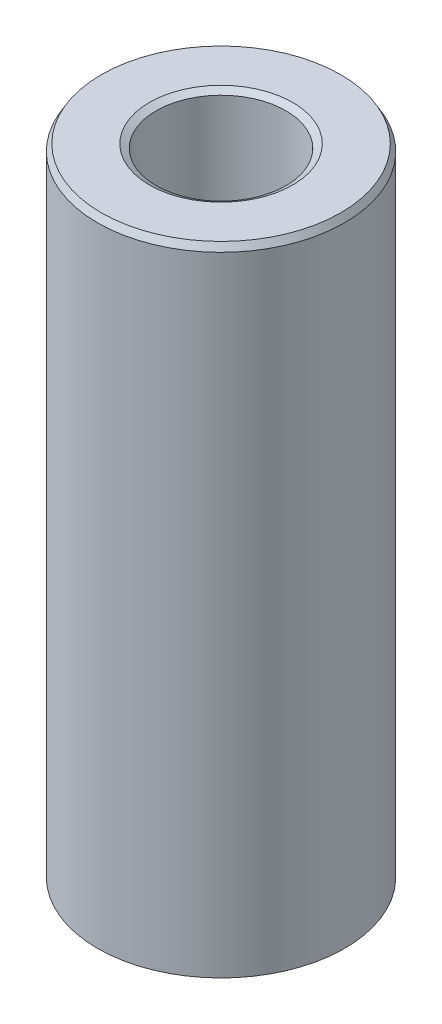
from build123d import *
from OCP.BRepFilletAPI import BRepFilletAPI_MakeChamfer

# Parameters (mm, degrees)
SKETCH1_R           = 52.5
BOSS_EXTRUDE1_DEPTH = 271.512539755
SKETCH2_R           = 27.581329118
CUT_EXTRUDE1_DEPTH  = 282.481010451
CHAMFER1_SIZE       = 2.849078489
CHAMFER1_SIZE2      = 1.644916233


with BuildPart() as part:
    # Sketch1 → Boss-Extrude1 (new body)
    with BuildSketch(Plane(origin=(0, 0, 0), x_dir=(1, 0, 0), z_dir=(0, 1, 0))):
        Circle(SKETCH1_R)
    extrude(amount=BOSS_EXTRUDE1_DEPTH)

    # Sketch2 → Cut-Extrude1 (cut, through all)
    with BuildSketch(Plane(origin=(0, 0, 0), x_dir=(1, 0, 0), z_dir=(0, 1, 0))):
        Circle(SKETCH2_R)
    extrude(amount=CUT_EXTRUDE1_DEPTH, mode=Mode.SUBTRACT)

    # Chamfer1: one chamfer whose edges measure the first distance from different faces: ONE call of the kernel's chamfer builder (chamfer() names one face for all edges)
    chamfer1_edges_1 = [part.edges().sort_by_distance(p)[0] for p in [
        (-27.581329118, 271.512539755, 0),
    ]]
    chamfer1_side_1 = [part.faces().sort_by_distance(p)[0] for p in [
        (-51.01507576, 271.512539755, 0),
    ]]
    chamfer1_edges_2 = [part.edges().sort_by_distance(p)[0] for p in [
        (-27.581329118, 0, 0),
    ]]
    chamfer1_side_2 = [part.faces().sort_by_distance(p)[0] for p in [
        (-27.581329118, 135.756269878, 0),
    ]]
    chamfer1_edges_3 = [part.edges().sort_by_distance(p)[0] for p in [
        (-52.5, 0, 0),
    ]]
    chamfer1_side_3 = [part.faces().sort_by_distance(p)[0] for p in [
        (-51.01507576, 0, 0),
    ]]
    chamfer1_edges_4 = [part.edges().sort_by_distance(p)[0] for p in [
        (-52.5, 271.512539755, 0),
    ]]
    chamfer1_side_4 = [part.faces().sort_by_distance(p)[0] for p in [
        (-52.5, 135.756269878, 0),
    ]]
    chamfer1 = BRepFilletAPI_MakeChamfer(part.part.solid().wrapped)
    for e in chamfer1_edges_1:
        chamfer1.Add(CHAMFER1_SIZE, CHAMFER1_SIZE2, e.wrapped, chamfer1_side_1[0].wrapped)  # the first distance lies on this face
    for e in chamfer1_edges_2:
        chamfer1.Add(CHAMFER1_SIZE, CHAMFER1_SIZE2, e.wrapped, chamfer1_side_2[0].wrapped)  # the first distance lies on this face
    for e in chamfer1_edges_3:
        chamfer1.Add(CHAMFER1_SIZE, CHAMFER1_SIZE2, e.wrapped, chamfer1_side_3[0].wrapped)  # the first distance lies on this face
    for e in chamfer1_edges_4:
        chamfer1.Add(CHAMFER1_SIZE, CHAMFER1_SIZE2, e.wrapped, chamfer1_side_4[0].wrapped)  # the first distance lies on this face
    add(Compound.cast(chamfer1.Shape()), mode=Mode.REPLACE)


solid = part.part
